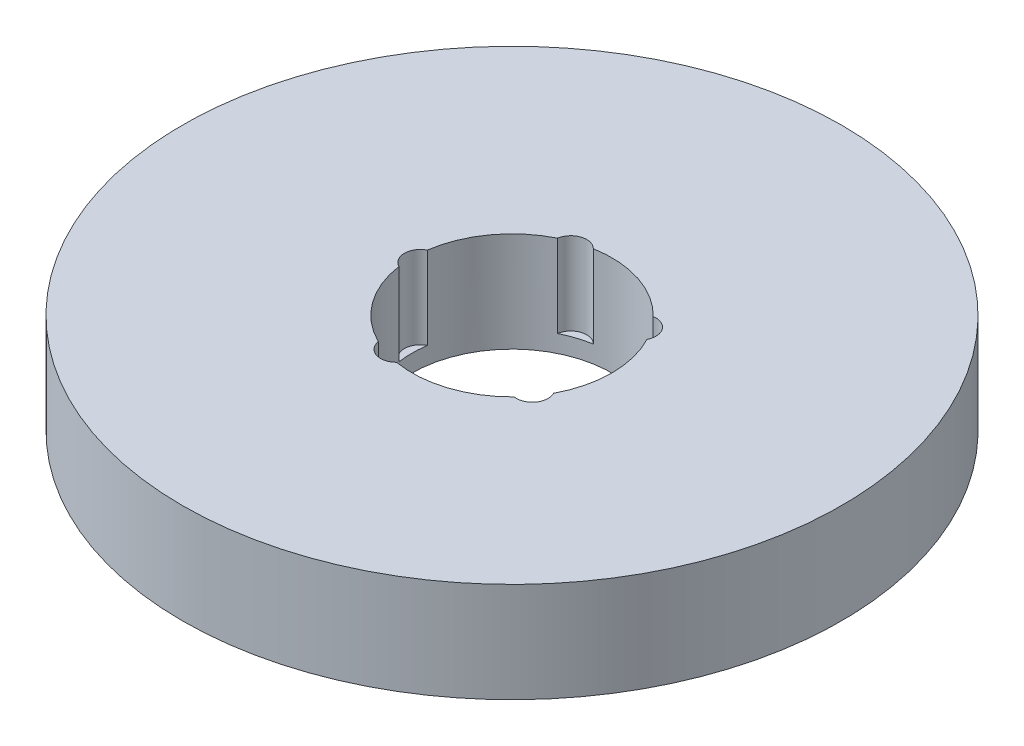
from build123d import *

# Parameters (mm, degrees)
SKETCH1_R           = 82.5
BOSS_EXTRUDE1_DEPTH = 25
SKETCH2_R           = 25
CUT_EXTRUDE1_DEPTH  = 120.320995638
SKETCH3_R           = 3.985166574
CUT_EXTRUDE2_DEPTH  = 20.666024786
CIRPATTERN1_COUNT   = 5


with BuildPart() as part:
    # Sketch1 → Boss-Extrude1 (new body)
    with BuildSketch(Plane(origin=(0, 0, 0), x_dir=(1, 0, 0), z_dir=(0, 1, 0))):
        Circle(SKETCH1_R)
    extrude(amount=BOSS_EXTRUDE1_DEPTH)

    # Sketch2 → Cut-Extrude1 (cut, through all)
    with BuildSketch(Plane(origin=(0, 0, 0), x_dir=(1, 0, 0), z_dir=(0, 1, 0))):
        Circle(SKETCH2_R)
    extrude(amount=CUT_EXTRUDE1_DEPTH, mode=Mode.SUBTRACT)

    # Sketch3 → Cut-Extrude2 (cut)
    with BuildSketch(Plane(origin=(0, 25, 0), x_dir=(1, 0, 0), z_dir=(0, 1, 0))):
        with Locations((-22.93971552, 0)):
            Circle(SKETCH3_R)
    cut_extrude2 = extrude(amount=-CUT_EXTRUDE2_DEPTH, mode=Mode.SUBTRACT)

    # CirPattern1: Cut-Extrude2 ×5 about axis
    cirpattern1_axis = Axis((0, 0, 0), (0, 1, 0))
    for i in range(1, CIRPATTERN1_COUNT):
        add(cut_extrude2.rotate(cirpattern1_axis, i * 360 / CIRPATTERN1_COUNT), mode=Mode.SUBTRACT)


solid = part.part
